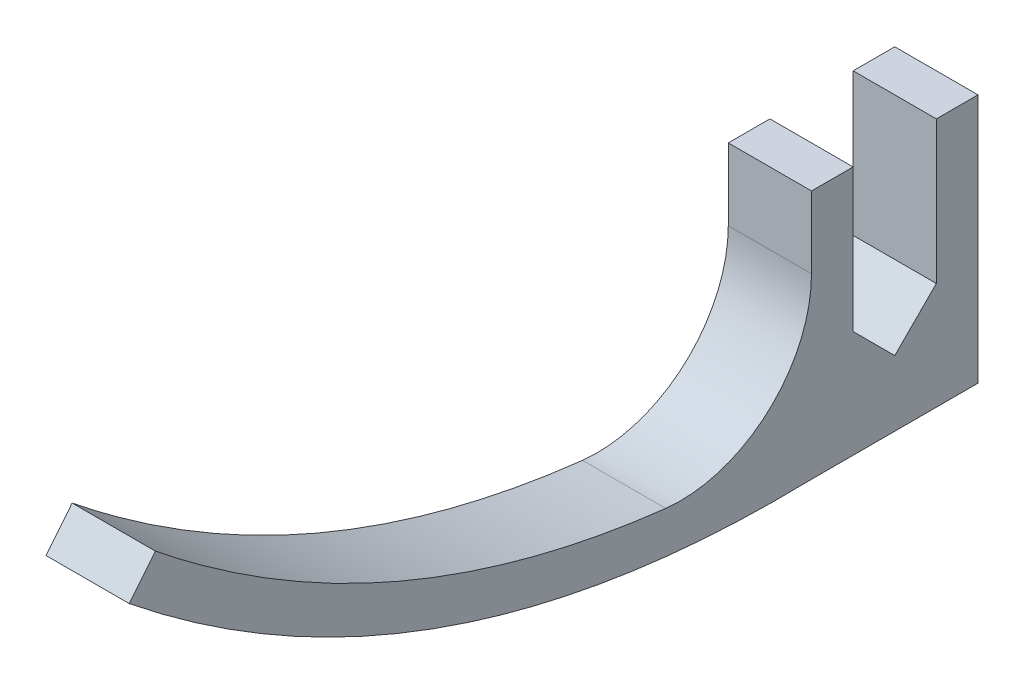
from build123d import *

# Parameters (mm, degrees)
BOSS_EXTRUDE1_DEPTH = 12.7
EXTRUDE_THIN1_START = -6.35
EXTRUDE_THIN1_DEPTH = 12.7
BOSS_EXTRUDE2_DEPTH = 12.7
FILLET2_R           = 20
CHAMFER1_SIZE       = 10


# Read off the part's stored shape, not the designer's step: Extrude-Thin1
with BuildPart() as part:
    # Sketch1 → Boss-Extrude1 (new body)
    with BuildSketch(Plane(origin=(0, 0, 0), x_dir=(0, 0, -1), z_dir=(1, 0, 0))):
        Polygon((72.847962895, 3.175), (72.847962895, 0), (98.247962895, 0), (98.247962895, 38.1), (91.897962895, 38.1), (91.897962895, 6.35), (79.197962895, 6.35), (79.197962895, 38.1), (72.847962895, 38.1), align=None)
    extrude(amount=BOSS_EXTRUDE1_DEPTH)



with BuildPart() as body_2:
    # Extrude-Thin1 outline → Extrude-Thin1 (new body)
    with BuildSketch(Plane(origin=(6.35, 0, 0), x_dir=(0, 0, -1), z_dir=(1, 0, 0)).offset(EXTRUDE_THIN1_START)):
        with BuildLine():
            Line((72.417611424, 0.000950446), (72.262248261, 6.349049554))
            add(Edge.make_bspline(
                [(72.262248261, 6.349049554), (63.021883212, 6.122901173), (54.028914036, 6.667445615), (36.522694485, 9.291097632), (28.009187017, 11.370086401), (11.442378767, 17.064926737), (3.388803369, 20.680920683), (-12.273002956, 29.461644656), (-19.881272632, 34.626626552), (-27.26926203, 40.573319228)],
                knots=[0, 0, 0, 0, 0.25, 0.25, 0.5, 0.5, 0.75, 0.75, 1, 1, 1, 1], degree=3))
            Line((-27.26926203, 40.573319228), (-31.250878284, 35.626680772))
            add(Edge.make_bspline(
                [(72.417611424, 0.000950446), (62.82712633, -0.233766762), (53.463624565, 0.331247938), (35.205660639, 3.067563666), (26.31145557, 5.238983498), (9.011597154, 11.185809829), (0.606218421, 14.961073948), (-15.70112511, 24.103715563), (-23.603051159, 29.470841193), (-31.250878284, 35.626680772)],
                knots=[0, 0, 0, 0, 0.25, 0.25, 0.5, 0.5, 0.75, 0.75, 1, 1, 1, 1], degree=3))
        make_face()
    extrude(amount=EXTRUDE_THIN1_DEPTH)


with BuildPart() as part_1:
    add(part.part)

    add(body_2.part)  # Boss-Extrude2 merges body 2
    # Sketch3 → Boss-Extrude2 (add)
    with BuildSketch(Plane(origin=(12.7, 0, 0), x_dir=(0, 0, -1), z_dir=(1, 0, 0))):
        Polygon((72.262248261, 6.349049554), (72.847962895, 6.349049554), (72.847962895, 0), (72.417611424, 0.000950446), align=None)
    extrude(amount=-BOSS_EXTRUDE2_DEPTH)

    # Fillet2
    fillet2_edges = [part_1.edges().sort_by_distance(p)[0] for p in [
        (6.35, 6.349049554, -72.847962895),
    ]]
    fillet(fillet2_edges, radius=FILLET2_R)

    # Chamfer1
    # the kernel refuses this chamfer: 10 mm, written as the material it adds along each edge
    with BuildSketch(Plane(origin=(0, 6.35, -91.897962895), x_dir=(0, -0.027495876610586664, 0.9996219169112968), z_dir=(1, 0, 0)), Plane(origin=(0, 6.35, -79.197962895), x_dir=(0, 0.9996219169112968, 0.027495876610586317), z_dir=(1, 0, 0))) as chamfer1_piece_1:
        Polygon((CHAMFER1_SIZE * 0.999621916911, -CHAMFER1_SIZE * 0.0274958766106), (-CHAMFER1_SIZE * 0.0274958766106, -CHAMFER1_SIZE * 0.999621916911), (0, 0), align=None)
    extrude(amount=12.7)


solid = part_1.part
